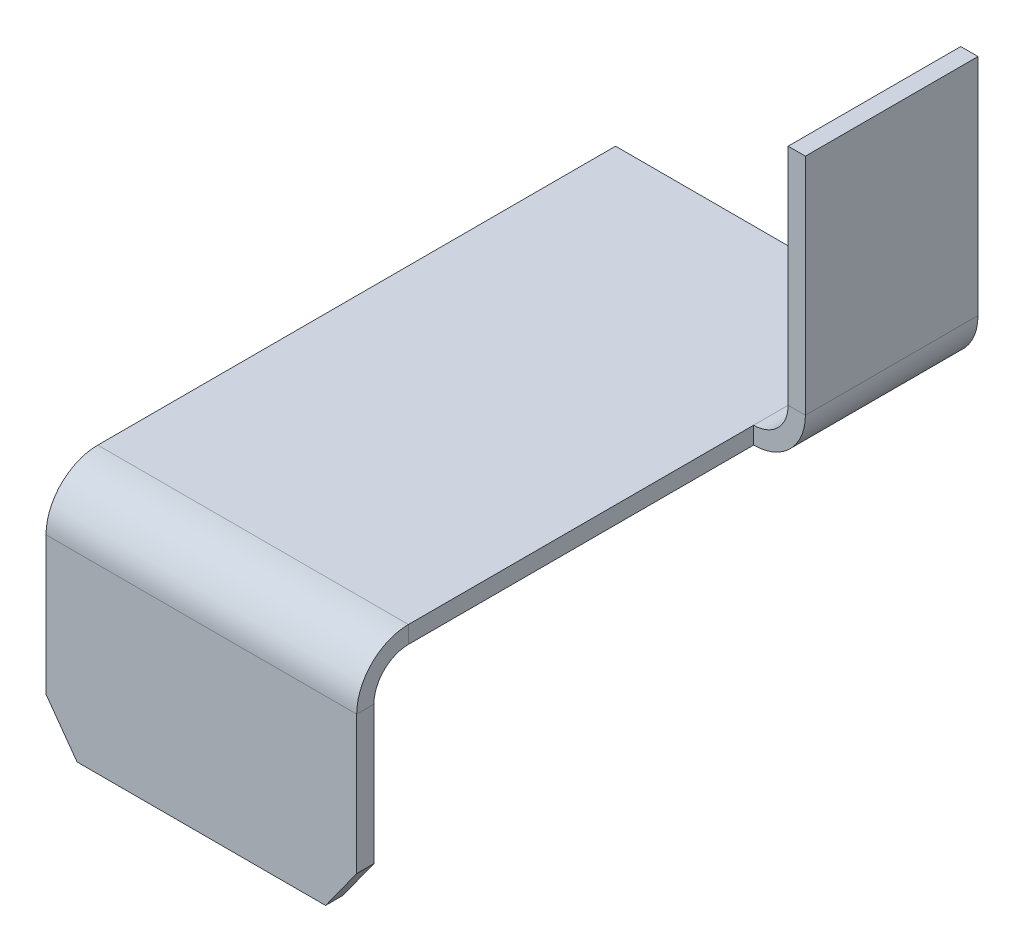
from build123d import *

# Parameters (mm, degrees)
SM_BASE_FLANGE_1_DEPTH      = 10
SM_EDGE_FLANGE_2_DEPTH      = 18
SM_START                    = 1
SM_EDGE_FLANGE_2_FLAT_DEPTH = 1


# Sheet-metal steps are written as plain solids
with BuildPart() as part:
    # Sketch 1 → 基体-法兰1 (new body)
    with BuildSketch(Plane.XY):
        with BuildLine():
            Line((0, 0), (18, 0))
            ThreePointArc((18, 0), (19.414213562, 0.585786438), (20, 2))
            Line((20, 2), (20, 15))
            Line((20, 15), (21, 15))
            Line((21, 15), (21, 2))
            ThreePointArc((21, 2), (20.121320344, -0.121320344), (18, -1))
            Line((18, -1), (0, -1))
            Line((0, -1), (0, 0))
        make_face()
    extrude(amount=SM_BASE_FLANGE_1_DEPTH)

    # 边线-法兰2 bend section (across the edge) → 边线-法兰2 (add)
    with BuildSketch(Plane(origin=(18, -1, 32), x_dir=(0, 0, -1), z_dir=(-1, 0, 0))):
        with BuildLine():
            Line((-1, 2), (0, 2))
            ThreePointArc((0, 2), (0.585786438, 0.585786438), (2, 0))
            Line((2, 0), (22, 0))
            Line((22, 0), (22, -1))
            Line((22, -1), (2, -1))
            ThreePointArc((2, -1), (-0.121320344, -0.121320344), (-1, 2))
        make_face()
    extrude(amount=SM_EDGE_FLANGE_2_DEPTH)

    # 边线-法兰2 profile (on flange) → 边线-法兰2 flat (add)
    with BuildSketch(Plane(origin=(0, -1, 32), x_dir=(-1, 0, 0), z_dir=(0, 0, 1)).offset(SM_START)):
        Polygon((0, 2), (0, 10), (-1.8, 12.5), (-16.2, 12.5), (-18, 10), (-18, 2), align=None)
    extrude(amount=-SM_EDGE_FLANGE_2_FLAT_DEPTH)


solid = part.part
